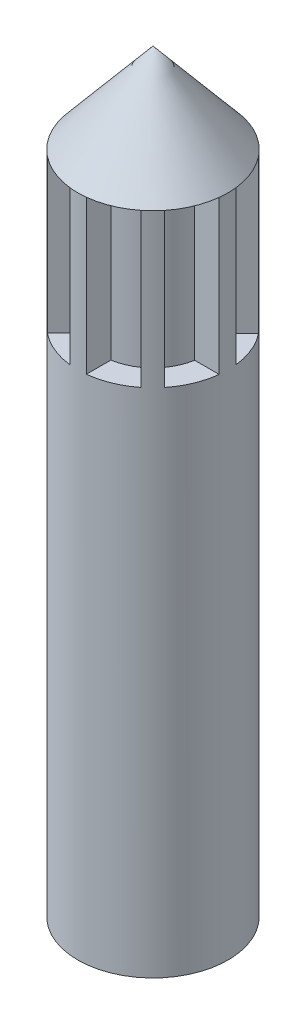
from build123d import *
from build123d.topology import SkipClean

# Parameters (mm, degrees)
BOSS_EXTRUDE1_DEPTH = 7.5
BOSS_EXTRUDE3_START = -7.5
SKETCH1_7_R         = 7.35
BOSS_EXTRUDE3_DEPTH = 50


with BuildPart() as part:
    # Sketch1 → Boss-Extrude1 (new, symmetric)
    with BuildSketch(Plane(origin=(0, 0, 0), x_dir=(1, 0, 0), z_dir=(0, 1, 0))):
        with BuildLine():
            ThreePointArc((6.122564101, 4.581600452), (5.584294246, 5.185414455), (4.982932131, 5.726422213))
            Line((4.982932131, 5.726422213), (3.28457771, 4.028067792))
            ThreePointArc((3.28457771, 4.028067792), (2.292289605, 4.584151566), (1.199538666, 4.9))
            Line((1.199538666, 4.9), (1.199538666, 7.303634322))
            ThreePointArc((1.199538666, 7.303634322), (0.391963425, 7.349981033), (-0.415814059, 7.307304058))
            Line((-0.415814059, 7.307304058), (-0.415814059, 4.905468202))
            ThreePointArc((-0.415814059, 4.905468202), (-1.510678314, 4.597025162), (-2.506708483, 4.047672132))
            Line((-2.506708483, 4.047672132), (-4.206334611, 5.747298261))
            ThreePointArc((-4.206334611, 5.747298261), (-4.810148615, 5.209028406), (-5.351156372, 4.60766629))
            Line((-5.351156372, 4.60766629), (-3.652801952, 2.909311869))
            ThreePointArc((-3.652801952, 2.909311869), (-4.208885725, 1.917023764), (-4.524734159, 0.824272826))
            Line((-4.524734159, 0.824272826), (-6.928368481, 0.824272826))
            ThreePointArc((-6.928368481, 0.824272826), (-6.974715193, 0.016697585), (-6.932038217, -0.791079899))
            Line((-6.932038217, -0.791079899), (-4.530202362, -0.791079899))
            ThreePointArc((-4.530202362, -0.791079899), (-4.221759321, -1.885944155), (-3.672406292, -2.881974323))
            Line((-3.672406292, -2.881974323), (-5.37203242, -4.581600452))
            ThreePointArc((-5.37203242, -4.581600452), (-4.833762565, -5.185414455), (-4.23240045, -5.726422213))
            Line((-4.23240045, -5.726422213), (-2.534046029, -4.028067792))
            ThreePointArc((-2.534046029, -4.028067792), (-1.541757924, -4.584151566), (-0.449006985, -4.9))
            Line((-0.449006985, -4.9), (-0.449006985, -7.303634322))
            ThreePointArc((-0.449006985, -7.303634322), (0.358568256, -7.349981033), (1.16634574, -7.307304058))
            Line((1.16634574, -7.307304058), (1.16634574, -4.905468202))
            ThreePointArc((1.16634574, -4.905468202), (2.261209995, -4.597025162), (3.257240164, -4.047672132))
            Line((3.257240164, -4.047672132), (4.956866292, -5.747298261))
            ThreePointArc((4.956866292, -5.747298261), (5.560680296, -5.209028406), (6.101688053, -4.60766629))
            Line((6.101688053, -4.60766629), (4.403333633, -2.909311869))
            ThreePointArc((4.403333633, -2.909311869), (4.959417406, -1.917023764), (5.275265841, -0.824272826))
            Line((5.275265841, -0.824272826), (7.678900162, -0.824272826))
            ThreePointArc((7.678900162, -0.824272826), (7.725246874, -0.016697585), (7.682569898, 0.791079899))
            Line((7.682569898, 0.791079899), (5.280734043, 0.791079899))
            ThreePointArc((5.280734043, 0.791079899), (4.972291002, 1.885944155), (4.422937973, 2.881974323))
            Line((4.422937973, 2.881974323), (6.122564101, 4.581600452))
        make_face()
    extrude(amount=BOSS_EXTRUDE1_DEPTH, both=True)

    # Boss-Extrude2 cone 1 section (through the dimple's axis) → Boss-Extrude2 (revolve)
    with BuildSketch(Plane(origin=(0.375265841, 7.5, 0), x_dir=(0, 0, -1), z_dir=(1, 0, 0))):
        Polygon((0, 0), (7.35, 0), (0, 8.759388906), align=None)
    revolve(axis=Axis((0.375265841, 7.5, 0), (0, 1, 0)))

    # Sketch1<7> → Boss-Extrude3 (add)
    with SkipClean():  # the faces are left unmerged after this step: merging them gives an invalid solid
        with BuildSketch(Plane(origin=(0, 0, 0), x_dir=(1, 0, 0), z_dir=(0, 1, 0)).offset(BOSS_EXTRUDE3_START)):
            with Locations(Location((0.375265841, 0, 0), (0, 0, 96.178708688))):
                Circle(SKETCH1_7_R)
        extrude(amount=-BOSS_EXTRUDE3_DEPTH)


solid = part.part
